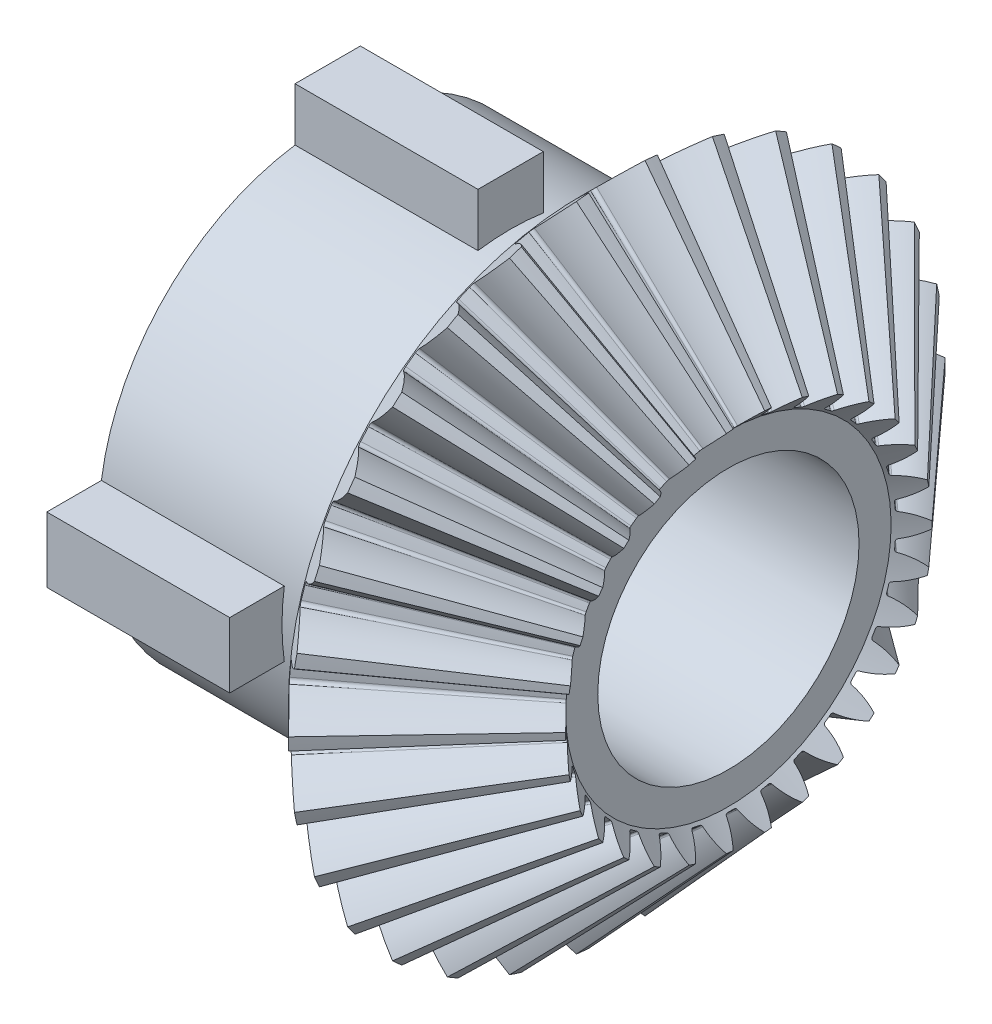
from build123d import *

# Parameters (mm, degrees)
TEETHCUTS_COUNT     = 30
TEETHCUTS_ANGLE     = 348
HUBSKE_R            = 8.75
HUB_DEPTH           = 9.65917486
BORSKE_R            = 5
BORE_DEPTH          = 22.5000508
SKETCH1_W           = 2.5
SKETCH1_H           = 3.440129379
SKETCH1_H_2         = 2.95570201
BOSS_EXTRUDE3_DEPTH = 7
SKETCH2_W           = 3.753349607
SKETCH2_H           = 2.5
SKETCH2_W_2         = 3.458598117
BOSS_EXTRUDE4_DEPTH = 7


with BuildPart() as part:
    # BasProSke → Base-Revolve (revolve)
    with BuildSketch(Plane(origin=(0, 0, 0), x_dir=(1, 0, 0), z_dir=(0, 1, 0)), mode=Mode.PRIVATE) as base_revolve_sk:
        Polygon((0, 0), (0, 11.159073261), (1.406612166, 12.565685424), (6.459913019, 7.012384561), (5.67494148, 6.227413023), (5.67494148, 0), align=None)
    revolve(base_revolve_sk.sketch.rotate(Axis((-10, 0, 0), (1, 0, 0)), 180), axis=Axis((-10, 0, 0), (1, 0, 0)))

    # ToothCut: read off the stored shape, not the designer's step
    # ToothCut: loft between two sections, ruled curve by curve
    toothcut_from = [
        Edge.make_bspline([(12.847300231, 0.006373491, -0.008946896), (12.842944603, 0.002017862, -0.015152536), (12.836793561, -0.004133179, -0.014268034), (12.833410296, -0.007516444, -0.006949565)], [0, 0, 0, 0, 1, 1, 1, 1], 3, [1, 0.752714571, 0.752714571, 1]),
        Edge.make_bspline([(12.833410296, -0.007516444, 0.006949565), (12.836793561, -0.004133179, 0.014268034), (12.842944603, 0.002017862, 0.015152536), (12.847300231, 0.006373491, 0.008946896)], [0, 0, 0, 0, 1, 1, 1, 1], 3, [1, 0.752714571, 0.752714571, 1]),
        Edge.make_bspline([(12.833410296, -0.007516444, -0.006949565), (12.832979803, -0.007946937, -0.00601835), (12.832639033, -0.008287707, -0.005015575), (12.832393827, -0.008532913, -0.003958429)], [0, 0, 0, 0, 1, 1, 1, 1], 3, [1, 0.994285284, 0.994285284, 1]),
        Edge.make_bspline([(12.832393827, -0.008532913, 0.003958429), (12.832639033, -0.008287707, 0.005015575), (12.832979803, -0.007946937, 0.00601835), (12.833410296, -0.007516444, 0.006949565)], [0, 0, 0, 0, 1, 1, 1, 1], 3, [1, 0.994285284, 0.994285284, 1]),
        Edge.make_bspline([(12.832393827, -0.008532913, -0.003958429), (12.831792233, -0.009134507, -0.001364802), (12.831792233, -0.009134507, 0.001364802), (12.832393827, -0.008532913, 0.003958429)], [0, 0, 0, 0, 1, 1, 1, 1], 3, [1, 0.966789815, 0.966789815, 1]),
        Edge.make_line((12.847300231, 0.006373491, 0.008946896), (12.847300231, 0.006373491, -0.008946896)),
    ]
    toothcut_to = [
        Edge.make_bspline([(1.545657618, 12.704730877, -1.243577752), (1.160511909, 12.319585168, -0.826758059), (0.721824165, 11.880897425, -0.534321367), (0.249368946, 11.408442207, -0.379449733)], [0, 0, 0, 0, 1, 1, 1, 1], 3, [1, 0.984974462, 0.984974462, 1]),
        Edge.make_bspline([(0.249368946, 11.408442207, 0.379449733), (0.721824165, 11.880897425, 0.534321367), (1.160511909, 12.319585168, 0.826758059), (1.545657618, 12.704730877, 1.243577752)], [0, 0, 0, 0, 1, 1, 1, 1], 3, [1, 0.984974462, 0.984974462, 1]),
        Edge.make_bspline([(0.249368946, 11.408442207, -0.379449733), (0.197873168, 11.356946428, -0.362569328), (0.165414848, 11.324488109, -0.303565147), (0.166509638, 11.325582899, -0.228824386)], [0, 0, 0, 0, 1, 1, 1, 1], 3, [1, 0.850930354, 0.850930354, 1]),
        Edge.make_bspline([(0.166509638, 11.325582899, 0.228824386), (0.165414848, 11.324488109, 0.303565147), (0.197873168, 11.356946428, 0.362569328), (0.249368946, 11.408442207, 0.379449733)], [0, 0, 0, 0, 1, 1, 1, 1], 3, [1, 0.850930354, 0.850930354, 1]),
        Edge.make_bspline([(0.166509638, 11.325582899, -0.228824386), (0.168743998, 11.327817259, -0.076285704), (0.168743998, 11.327817259, 0.076285704), (0.166509638, 11.325582899, 0.228824386)], [0, 0, 0, 0, 1, 1, 1, 1], 3, [1, 0.999857007, 0.999857007, 1]),
        Edge.make_line((1.545657618, 12.704730877, 1.243577752), (1.545657618, 12.704730877, -1.243577752)),
    ]
    toothcut = Solid(Shell([*[Face.make_surface_from_curves(toothcut_from[k], toothcut_to[k]) for k in range(6)], Face(Wire(toothcut_from)), Face(Wire(toothcut_to))]))
    add(toothcut, mode=Mode.SUBTRACT)

    # TeethCuts: ToothCut ×30 about axis
    teethcuts_axis = Axis((-10, 0, 0), (1, 0, 0))
    for i in range(1, TEETHCUTS_COUNT):
        add(toothcut.rotate(teethcuts_axis, i * TEETHCUTS_ANGLE / (TEETHCUTS_COUNT - 1)), mode=Mode.SUBTRACT)

    # HubSke → Hub (add)
    with BuildSketch(Plane.ZY):
        with Locations(Location((0, 0, 0), (0, 0, 180))):
            Circle(HUBSKE_R)
    extrude(amount=HUB_DEPTH)

    # BorSke → Bore (cut, symmetric)
    with BuildSketch(Plane(origin=(0, 0, 0), x_dir=(0, 0, -1), z_dir=(1, 0, 0))):
        with Locations(Location((0, 0, 0), (0, 0, 180))):
            Circle(BORSKE_R)
    extrude(amount=BORE_DEPTH, both=True, mode=Mode.SUBTRACT)

    # Sketch1 → Boss-Extrude3 (add)
    with BuildSketch(Plane.ZY.offset(9.65917486)):
        with Locations((0, 8.972604636)):
            Rectangle(SKETCH1_W, SKETCH1_H)
        with Locations((0, -9.21481832)):
            Rectangle(SKETCH1_W, SKETCH1_H_2)
    extrude(amount=-BOSS_EXTRUDE3_DEPTH)

    # Sketch2 → Boss-Extrude4 (add)
    with BuildSketch(Plane.ZY.offset(9.65917486)):
        with Locations((-8.873325196, 0)):
            Rectangle(SKETCH2_W, SKETCH2_H)
        with Locations((9.020700941, 0)):
            Rectangle(SKETCH2_W_2, SKETCH2_H)
    extrude(amount=-BOSS_EXTRUDE4_DEPTH)


solid = part.part
